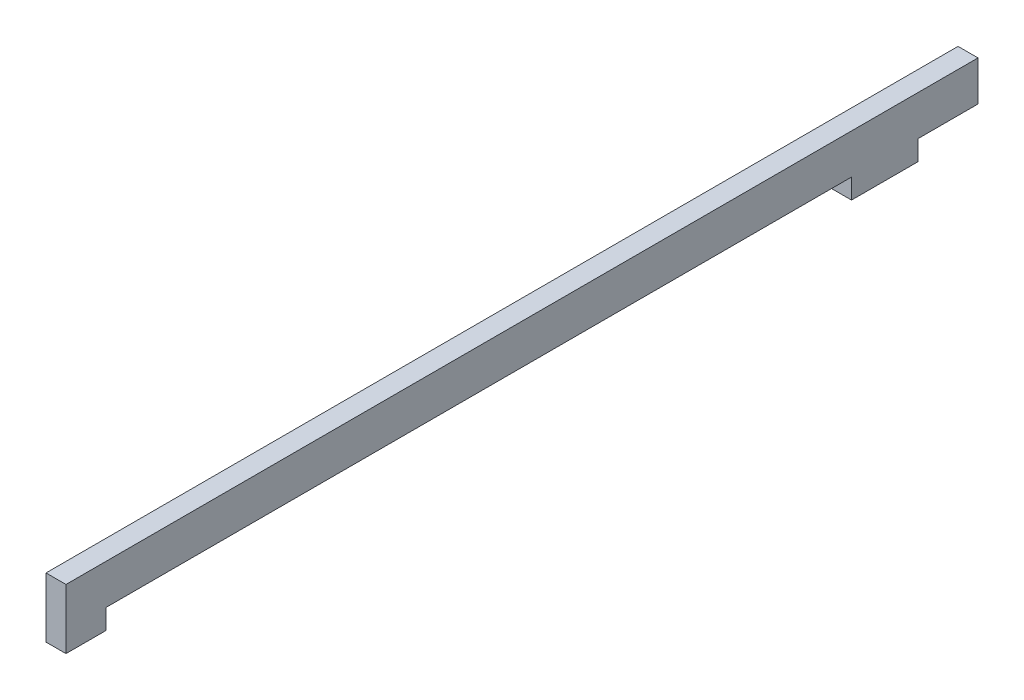
from build123d import *

# Parameters (mm, degrees)
EXTRUDE_START            = -274
SKETCH_1_W               = 6
SKETCH_1_H               = 12
EXTRUDE_1_DEPTH          = 268
CUT_EXTRUDE_2_DEPTH      = 335.505178406
CUT_EXTRUDE_2_DEPTH_BACK = 335.505178406
SKETCH_3106_W            = 6
SKETCH_3106_H            = 6.1
EXTRUDE_3215_DEPTH       = 6
OTHER_START              = 57.8
OTHER_3265_OUTLINE_W     = 6
OTHER_3265_OUTLINE_H     = 6
OTHER_3265_DEPTH         = 5.8
SKETCH_3419_W            = 24
SKETCH_3419_H            = 12
EXTRUDE_3519_DEPTH       = 6
OTHER_START_2            = -176.272727273
OTHER_3590_OUTLINE_W     = 6
OTHER_3590_OUTLINE_H     = 20
OTHER_3590_DEPTH         = 6
SKETCH_2_W               = 6
SKETCH_2_H               = 12.2
EXTRUDE_2_DEPTH          = 6


# Read off the part's stored shape, not the designer's step: Шип_паз_Задняя_рамка_выступов, Шип_паз_Передний_в_пол_ячейки
with BuildPart() as part:
    # Эскиз1 → Бобышка-Вытянуть1 (new body)
    with BuildSketch(Plane.XY.offset(EXTRUDE_START)):
        with Locations((-173.272727273, 69.8)):
            Rectangle(SKETCH_1_W, SKETCH_1_H)
    extrude(amount=EXTRUDE_1_DEPTH)

    # Sketch 3011 → Стык_полозьев_2_секции (cut, two sides: drawn at the far end of the back side and taken through both)
    with BuildSketch(Plane(origin=(0, 0, 0), x_dir=(0, 0, -1), z_dir=(1, 0, 0)).offset(-CUT_EXTRUDE_2_DEPTH_BACK)):
        Polygon((140.075, 62.8), (139.925, 62.8), (139.925, 66.725), (127.925, 66.725), (127.925, 72.875), (139.925, 72.875), (139.925, 76.8), (140.075, 76.8), (140.075, 72.725), (128.075, 72.725), (128.075, 66.875), (140.075, 66.875), align=None)
    extrude(amount=CUT_EXTRUDE_2_DEPTH + CUT_EXTRUDE_2_DEPTH_BACK, mode=Mode.SUBTRACT)


with BuildPart() as cut_extrude_2_piece_1:
    # of the separate pieces the step leaves, piece 1, a body of its own (cut_extrude_2_pieces)
    add(part.part.solids().sort_by_distance((-176.272727273, 75.8, -274))[0])



with BuildPart() as cut_extrude_2_piece_2:
    # of the separate pieces the step leaves, piece 2, a body of its own (cut_extrude_2_pieces)
    add(part.part.solids().sort_by_distance((-176.272727273, 75.8, -139.925))[0])

    # Sketch 3106 → Extrude 3215 (add)
    with BuildSketch(Plane.ZY.offset(176.272727273)):
        with Locations((-9, 60.85)):
            Rectangle(SKETCH_3106_W, SKETCH_3106_H)
    extrude(amount=-EXTRUDE_3215_DEPTH)

    # Other 3265 outline → Other 3265 (add)
    with BuildSketch(Plane(origin=(0, 0, 0), x_dir=(1, 0, 0), z_dir=(0, 1, 0)).offset(OTHER_START)):
        with Locations((-173.272727273, 3)):
            Rectangle(OTHER_3265_OUTLINE_W, OTHER_3265_OUTLINE_H)
    extrude(amount=OTHER_3265_DEPTH)


with BuildPart() as cut_extrude_2_piece_1_1:
    add(cut_extrude_2_piece_1.part)

    add(cut_extrude_2_piece_2.part)  # Extrude 3519 merges Стык_полозьев_2_секции piece 2
    # Sketch 3419 → Extrude 3519 (add)
    with BuildSketch(Plane.ZY.offset(176.272727273)):
        with Locations((-134, 69.8)):
            Rectangle(SKETCH_3419_W, SKETCH_3419_H)
    extrude(amount=-EXTRUDE_3519_DEPTH)

    # Other 3590 outline → Other 3590 (add)
    with BuildSketch(Plane.YZ.offset(OTHER_START_2)):
        with Locations((60.8, -246)):
            Rectangle(OTHER_3590_OUTLINE_W, OTHER_3590_OUTLINE_H)
    extrude(amount=OTHER_3590_DEPTH)

    # Эскиз2 → Бобышка-Вытянуть2 (add)
    with BuildSketch(Plane.XY.offset(-6)):
        with Locations((-173.272727273, 69.7)):
            Rectangle(SKETCH_2_W, SKETCH_2_H)
    extrude(amount=EXTRUDE_2_DEPTH)


solid = cut_extrude_2_piece_1_1.part
